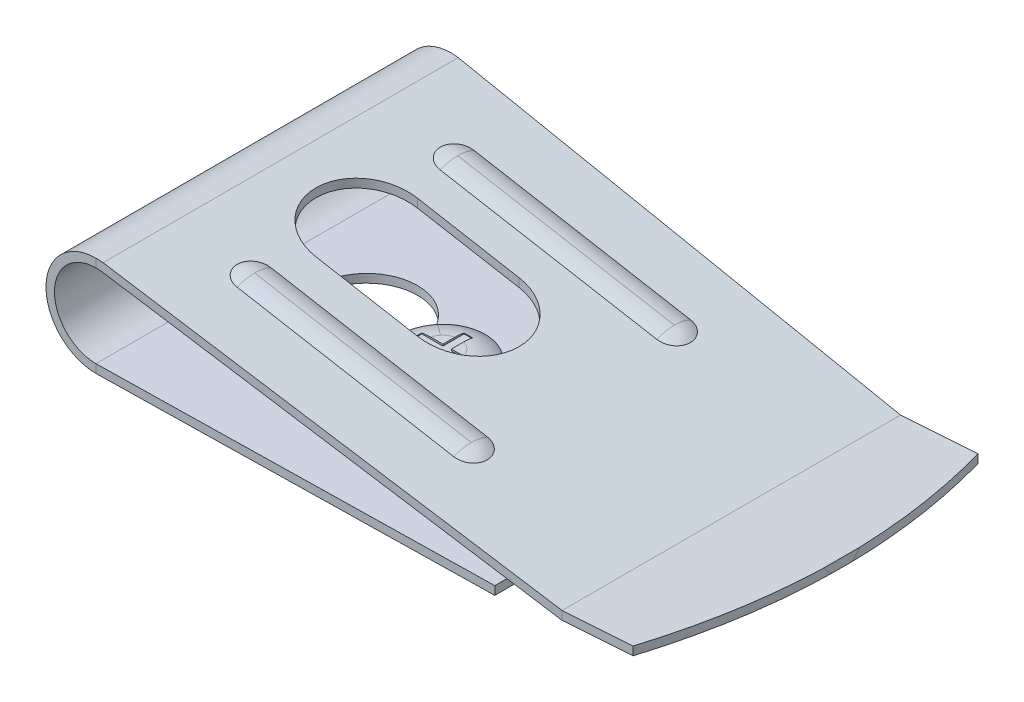
from build123d import *

# Parameters (mm, degrees)
BOSS_EXTRUDE1_DEPTH = 21
CUT_EXTRUDE1_START  = -5.9
CUT_EXTRUDE1_DEPTH  = 5.9
SKETCH3_W           = 10
SKETCH3_H           = 23.477945608
CUT_EXTRUDE2_DEPTH  = 0.5
CUT_EXTRUDE3_DEPTH  = 0.5
CUT_EXTRUDE4_DEPTH  = 11.5
BOSS_EXTRUDE2_DEPTH = 0.25
FILLET1_R           = 2.1
SKETCH7_R           = 2.5
BOSS_EXTRUDE3_DEPTH = 0.5
SKETCH8_W           = 0.5
SKETCH8_H           = 1.25
SKETCH8_H_2         = 0.5
SKETCH8_W_2         = 1.25
CUT_EXTRUDE5_DEPTH  = 0.1
FILLET2_R           = 2.49


# Read off the part's stored shape, not the designer's step: Cut-Extrude1
with BuildPart() as part:
    # Sketch1 → Boss-Extrude1 (new body)
    with BuildSketch(Plane.XY):
        with BuildLine():
            Line((0.012557203, -0.500251932), (-5.974554862, -0.89330298))
            Line((-5.974554862, -0.89330298), (-32.650528742, 3.842496807))
            ThreePointArc((-32.650528742, 3.842496807), (-35.431616847, 1.584631463), (-32.987442797, -1.0342271))
            Line((-32.987442797, -1.0342271), (0.012557203, -1.0342271))
            Line((0.012557203, -1.0342271), (0.012557203, -1.5342271))
            Line((0.012557203, -1.5342271), (-32.987442797, -1.5342271))
            ThreePointArc((-32.987442797, -1.5342271), (-35.930083434, 1.624018145), (-32.571991326, 4.336372166))
            Line((-32.571991326, 4.336372166), (-5.946831197, -0.390406628))
            Line((-5.946831197, -0.390406628), (0, 0))
            Line((0, 0), (0.012557203, -0.500251932))
        make_face()
    extrude(amount=BOSS_EXTRUDE1_DEPTH)

    # Cut-Extrude1 outline → Cut-Extrude1 (cut)
    with BuildSketch(Plane.XZ.offset(1.5342271).offset(CUT_EXTRUDE1_START)):
        with BuildLine():
            Line((0.012557203, 0), (0.012557203, 9.343939236))
            add(Edge.make_bspline(
                [(0.012557203, 9.343939236), (-0.067700916, 4.933400966), (-1.372327976, 0.5)],
                knots=[0.559253537, 0.559253537, 0.559253537, 1, 1, 1], degree=2))
            Line((-1.372327976, 0.5), (-5.946831197, 0.5))
            Line((-5.946831197, 0.5), (-32.987442797, 0))
            Line((-32.987442797, 0), (0.012557203, 0))
        make_face()
        with BuildLine():
            add(Edge.make_bspline(
                [(-1.755064488, 20.5), (-0.078758631, 15.514798295), (0.012557203, 10.5)],
                knots=[0, 0, 0, 0.501471147, 0.501471147, 0.501471147], degree=2))
            Line((0.012557203, 10.5), (0.012557203, 21))
            Line((0.012557203, 21), (-32.987442797, 21))
            Line((-32.987442797, 21), (-5.946831197, 20.5))
            Line((-5.946831197, 20.5), (-1.755064488, 20.5))
        make_face()
    extrude(amount=CUT_EXTRUDE1_DEPTH, mode=Mode.SUBTRACT)

    # Sketch3 → Cut-Extrude2 (cut)
    with BuildSketch(Plane.XZ.offset(1.5342271)):
        with Locations((-4.846794028, 9.392909882)):
            Rectangle(SKETCH3_W, SKETCH3_H)
    extrude(amount=-CUT_EXTRUDE2_DEPTH, mode=Mode.SUBTRACT)

    # Sketch4 → Cut-Extrude3 (cut)
    with BuildSketch(Plane.XZ.offset(1.5342271)):
        with BuildLine():
            Line((-22.987442797, 12), (-24.889366586, 12))
            ThreePointArc((-24.889366586, 12), (-30.487442797, 10.5), (-24.889366586, 9))
            Line((-24.889366586, 9), (-22.987442797, 9))
            ThreePointArc((-22.987442797, 9), (-21.487442797, 10.5), (-22.987442797, 12))
        make_face()
    extrude(amount=-CUT_EXTRUDE3_DEPTH, mode=Mode.SUBTRACT)

    # Sketch5 → Cut-Extrude4 (cut)
    with BuildSketch(Plane(origin=(0, -1.0342271, 0), x_dir=(1, 0, 0), z_dir=(0, 1, 0))):
        with BuildLine():
            Line((-27.487442797, -13.5), (-21.487442797, -13.5))
            ThreePointArc((-21.487442797, -13.5), (-18.487442797, -10.5), (-21.487442797, -7.5))
            Line((-21.487442797, -7.5), (-27.487442797, -7.5))
            ThreePointArc((-27.487442797, -7.5), (-30.487442797, -10.5), (-27.487442797, -13.5))
        make_face()
    extrude(amount=CUT_EXTRUDE4_DEPTH, mode=Mode.SUBTRACT)

    # Sketch6 → Boss-Extrude2 (add)
    with BuildSketch(Plane(origin=(-0.248891567, -1.401964872, 0), x_dir=(0.9846044320073983, -0.1747973468659884, 0), z_dir=(0.17479734686598838, 0.9846044320073982, 0))):
        with BuildLine():
            Line((-28.339083857, -3.5), (-15.339083857, -3.5))
            ThreePointArc((-15.339083857, -3.5), (-14.339083857, -4.5), (-15.339083857, -5.5))
            Line((-15.339083857, -5.5), (-28.339083857, -5.5))
            ThreePointArc((-28.339083857, -5.5), (-29.339083857, -4.5), (-28.339083857, -3.5))
        make_face()
        with BuildLine():
            Line((-28.339083857, -15.5), (-15.339083857, -15.5))
            ThreePointArc((-15.339083857, -15.5), (-14.339083857, -16.5), (-15.339083857, -17.5))
            Line((-15.339083857, -17.5), (-28.339083857, -17.5))
            ThreePointArc((-28.339083857, -17.5), (-29.339083857, -16.5), (-28.339083857, -15.5))
        make_face()
    extrude(amount=BOSS_EXTRUDE2_DEPTH)

    # Fillet1
    # the kernel refuses this fillet: 2.1 mm, written as the material it takes off along each edge
    with BuildSketch(Plane(origin=(-28.107979795, 3.797782907, 3.5), x_dir=(-0.1747973468659884, -0.9846044320073982, 0), z_dir=(0.9846044320073983, -0.1747973468659884, 0)), Plane(origin=(-15.308122178, 1.525417398, 5.5), x_dir=(-0.17479734686598844, -0.9846044320073983, 0), z_dir=(-0.9846044320073983, 0.1747973468659884, 0)), Plane(origin=(-28.107979795, 3.797782907, 15.5), x_dir=(-0.1747973468659884, -0.9846044320073983, 0), z_dir=(0.9846044320073983, -0.1747973468659884, 0)), Plane(origin=(-15.308122178, 1.525417398, 17.5), x_dir=(-0.17479734686598838, -0.9846044320073983, 0), z_dir=(-0.9846044320073983, 0.1747973468659884, 0))) as fillet1_piece_1:
        with BuildLine():
            CenterArc((2.1, -0.993730346), FILLET1_R, 151.757462816, 28.242537184)
            Line((0, -0.993730346), (-0.042, -0.993730346))
            Line((-0.042, -0.993730346), (-0.042, 0))
            Line((-0.042, 0), (0, 0.042))
            ThreePointArc((0, 0.042), (0.125, 0.042), (0.213, 0.019874607))
            Line((0.213, 0.019874607), (0.25, 0))
        make_face()
    extrude(amount=13, mode=Mode.SUBTRACT)
    with BuildSketch(Plane(origin=(-15.308122178, 1.525417398, 16.5), x_dir=(0, 0, -1), z_dir=(-0.9846044320073983, 0.1747973468659884, 0))) as fillet1_piece_2:
        with BuildLine():
            CenterArc((0.006269654, 2.1), FILLET1_R, 270, 28.242537184)
            Line((0.006269654, 0), (0.006269654, -0.042))
            Line((0.006269654, -0.042), (1, -0.042))
            Line((1, -0.042), (1.042, 0))
            ThreePointArc((1.042, 0), (1.042, 0.125), (1.019874607, 0.213))
            Line((1.019874607, 0.213), (1, 0.25))
        make_face()
    revolve(axis=Axis((-15.308122178, 1.525417398, 16.5), (-0.1747973468659884, -0.9846044320073983, 0)), revolution_arc=180, mode=Mode.SUBTRACT)
    with BuildSketch(Plane(origin=(-28.107979795, 3.797782907, 16.5), x_dir=(0, 0, 1), z_dir=(0.9846044320073983, -0.1747973468659884, 0))) as fillet1_piece_3:
        with BuildLine():
            CenterArc((0.006269654, 2.1), FILLET1_R, 270, 28.242537184)
            Line((0.006269654, 0), (0.006269654, -0.042))
            Line((0.006269654, -0.042), (1, -0.042))
            Line((1, -0.042), (1.042, 0))
            ThreePointArc((1.042, 0), (1.042, 0.125), (1.019874607, 0.213))
            Line((1.019874607, 0.213), (1, 0.25))
        make_face()
    revolve(axis=Axis((-28.107979795, 3.797782907, 16.5), (-0.1747973468659884, -0.9846044320073983, 0)), revolution_arc=180, mode=Mode.SUBTRACT)
    with BuildSketch(Plane(origin=(-15.308122178, 1.525417398, 4.5), x_dir=(0, 0, -1), z_dir=(-0.9846044320073983, 0.1747973468659884, 0))) as fillet1_piece_4:
        with BuildLine():
            CenterArc((0.006269654, 2.1), FILLET1_R, 270, 28.242537184)
            Line((0.006269654, 0), (0.006269654, -0.042))
            Line((0.006269654, -0.042), (1, -0.042))
            Line((1, -0.042), (1.042, 0))
            ThreePointArc((1.042, 0), (1.042, 0.125), (1.019874607, 0.213))
            Line((1.019874607, 0.213), (1, 0.25))
        make_face()
    revolve(axis=Axis((-15.308122178, 1.525417398, 4.5), (-0.1747973468659884, -0.9846044320073983, 0)), revolution_arc=180, mode=Mode.SUBTRACT)
    with BuildSketch(Plane(origin=(-28.107979795, 3.797782907, 4.5), x_dir=(0, 0, 1), z_dir=(0.9846044320073983, -0.1747973468659884, 0))) as fillet1_piece_5:
        with BuildLine():
            CenterArc((0.006269654, 2.1), FILLET1_R, 270, 28.242537184)
            Line((0.006269654, 0), (0.006269654, -0.042))
            Line((0.006269654, -0.042), (1, -0.042))
            Line((1, -0.042), (1.042, 0))
            ThreePointArc((1.042, 0), (1.042, 0.125), (1.019874607, 0.213))
            Line((1.019874607, 0.213), (1, 0.25))
        make_face()
    revolve(axis=Axis((-28.107979795, 3.797782907, 4.5), (-0.1747973468659884, -0.9846044320073983, 0)), revolution_arc=180, mode=Mode.SUBTRACT)

    # Sketch7 → Boss-Extrude3 (add)
    with BuildSketch(Plane(origin=(0, -1.0342271, 0), x_dir=(1, 0, 0), z_dir=(0, 1, 0))):
        with Locations(Location((-22.987442797, -10.5, 0), (0, 0, 218.942441269))):
            Circle(SKETCH7_R)
    extrude(amount=BOSS_EXTRUDE3_DEPTH)

    # Sketch8 → Cut-Extrude5 (cut)
    with BuildSketch(Plane(origin=(0, -0.5342271, 0), x_dir=(1, 0, 0), z_dir=(0, 1, 0))):
        with Locations((-22.987442797, -11.375)):
            Rectangle(SKETCH8_W, SKETCH8_H)
        with Locations((-22.987442797, -10.5)):
            Rectangle(SKETCH8_W, SKETCH8_H_2)
        with Locations((-22.987442797, -9.625)):
            Rectangle(SKETCH8_W, SKETCH8_H)
        with Locations((-23.862442797, -10.5)):
            Rectangle(SKETCH8_W_2, SKETCH8_H_2)
        with Locations((-22.112442797, -10.5)):
            Rectangle(SKETCH8_W_2, SKETCH8_H_2)
    extrude(amount=-CUT_EXTRUDE5_DEPTH, mode=Mode.SUBTRACT)

    # Fillet2
    # the kernel refuses this fillet: 2.49 mm, written as the material it takes off along each edge
    with BuildSketch(Plane(origin=(-22.987442797, -0.5342271, 10.5), x_dir=(-0.777777777777574, 0, 0.6285393610549612), z_dir=(-0.6285393610549612, 0, -0.777777777777574))) as fillet2_piece_1:
        with BuildLine():
            CenterArc((1.003337045, -2.49), FILLET2_R, 53.053469485, 36.946530515)
            Line((1.003337045, 0), (1.003337045, 0.0498))
            Line((1.003337045, 0.0498), (2.5, 0.0498))
            Line((2.5, 0.0498), (2.5498, 0))
            ThreePointArc((2.5498, 0), (2.5498, -0.25), (2.529933259, -0.4602))
            Line((2.529933259, -0.4602), (2.5, -0.5))
        make_face()
    revolve(axis=Axis((-22.987442797, -0.5342271, 10.5), (0, 1, 0)), mode=Mode.SUBTRACT)


solid = part.part
